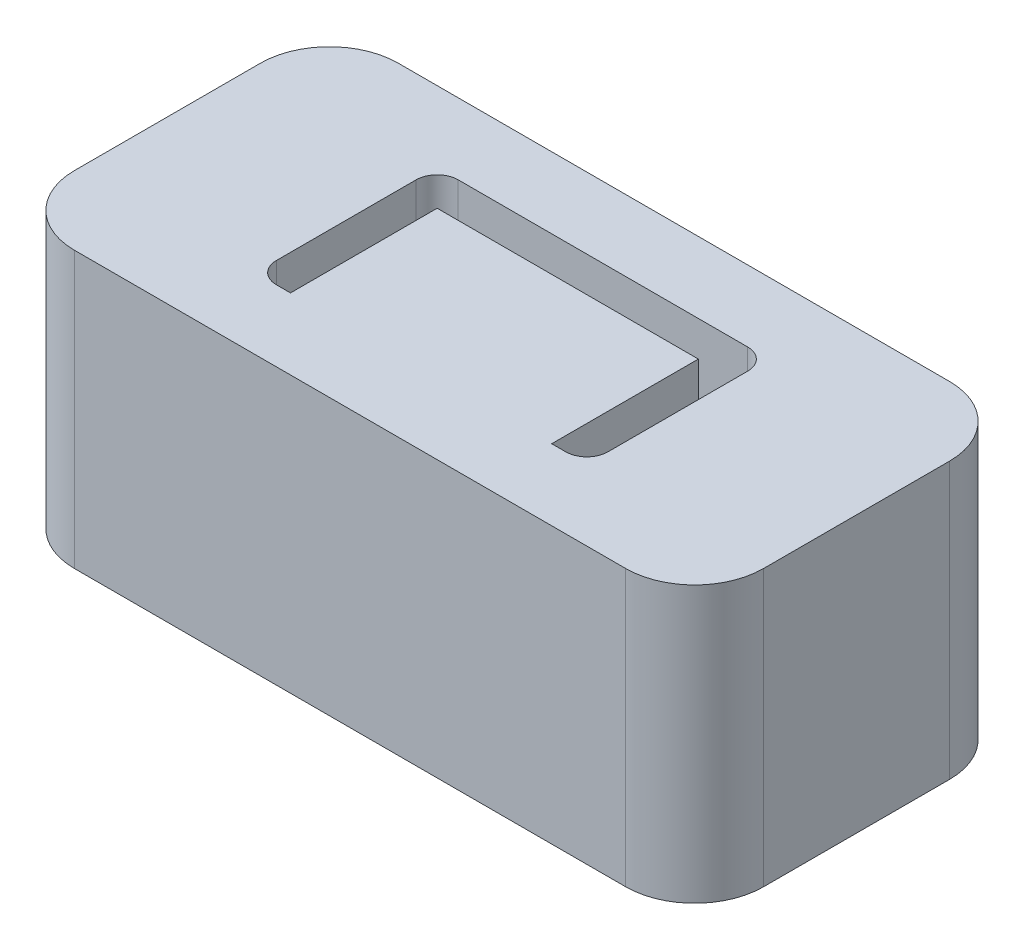
from build123d import *

# Parameters (mm, degrees)
SKETCH2_W                   = 100
SKETCH2_H                   = 47
BOSS_EXTRUDE1_DEPTH         = 40
FILLET1_R                   = 10
CUT_EXTRUDE1_REACH          = 70.207
M6_TAPPED_HOLE1_D           = 5
M6_TAPPED_HOLE1_DEPTH       = 17
M6_TAPPED_HOLE1_CSINK_D     = 6.05
M6_TAPPED_HOLE1_CSINK_ANGLE = 90
M6_TAPPED_HOLE1_TIP         = 1.502151548


with BuildPart() as part:
    # Sketch2 → Boss-Extrude1 (new body)
    with BuildSketch(Plane(origin=(0, 0, 0), x_dir=(1, 0, 0), z_dir=(0, 1, 0))):
        Rectangle(SKETCH2_W, SKETCH2_H)
    extrude(amount=-BOSS_EXTRUDE1_DEPTH)

    # Fillet1
    fillet1_edges = [part.edges().sort_by_distance(p)[0] for p in [
        (-50, -20, -23.5),
        (50, -20, -23.5),
        (50, -20, 23.5),
        (-50, -20, 23.5),
    ]]
    fillet(fillet1_edges, radius=FILLET1_R)

    # Sketch3 → Cut-Extrude1 (cut, up to next)
    with BuildSketch(Plane(origin=(0, 0, 0), x_dir=(1, 0, 0), z_dir=(0, 1, 0)), mode=Mode.PRIVATE) as cut_extrude1_sk1:
        with BuildLine():
            Line((24.05, -10.14), (24.05, 10.14))
            ThreePointArc((24.05, 10.14), (23.156675683, 12.296675683), (21, 13.19))
            Line((21, 13.19), (-21, 13.19))
            ThreePointArc((-21, 13.19), (-23.156675683, 12.296675683), (-24.05, 10.14))
            Line((-24.05, 10.14), (-24.05, -10.14))
            ThreePointArc((-24.05, -10.14), (-23.156675683, -12.296675683), (-21, -13.19))
            Line((-21, -13.19), (-18.95, -13.19))
            Line((-18.95, -13.19), (-18.95, 8.09))
            Line((-18.95, 8.09), (18.95, 8.09))
            Line((18.95, 8.09), (18.95, -13.19))
            Line((18.95, -13.19), (21, -13.19))
            ThreePointArc((21, -13.19), (23.156675683, -12.296675683), (24.05, -10.14))
        make_face()
    cut_extrude1_tool1 = extrude(cut_extrude1_sk1.sketch, amount=-CUT_EXTRUDE1_REACH, mode=Mode.PRIVATE) & part.part
    add(cut_extrude1_tool1.solids().sort_by_distance((23.50141, 0, 0))[0], mode=Mode.SUBTRACT)

    # M6 Tapped Hole1
    with Locations(Plane(origin=(0, -40, 0), x_dir=(-1, 0, 0), z_dir=(0, -1, 0))):
        with Locations((-43, 16.5), (43, 16.5), (43, -16.5), (-43, -16.5)):
            CounterSinkHole(M6_TAPPED_HOLE1_D / 2, M6_TAPPED_HOLE1_CSINK_D / 2, depth=M6_TAPPED_HOLE1_DEPTH, counter_sink_angle=M6_TAPPED_HOLE1_CSINK_ANGLE)
            with Locations((0, 0, -(M6_TAPPED_HOLE1_DEPTH + M6_TAPPED_HOLE1_TIP / 2))):  # 118° drill point
                Cone(0, M6_TAPPED_HOLE1_D / 2, M6_TAPPED_HOLE1_TIP, mode=Mode.SUBTRACT)


solid = part.part
